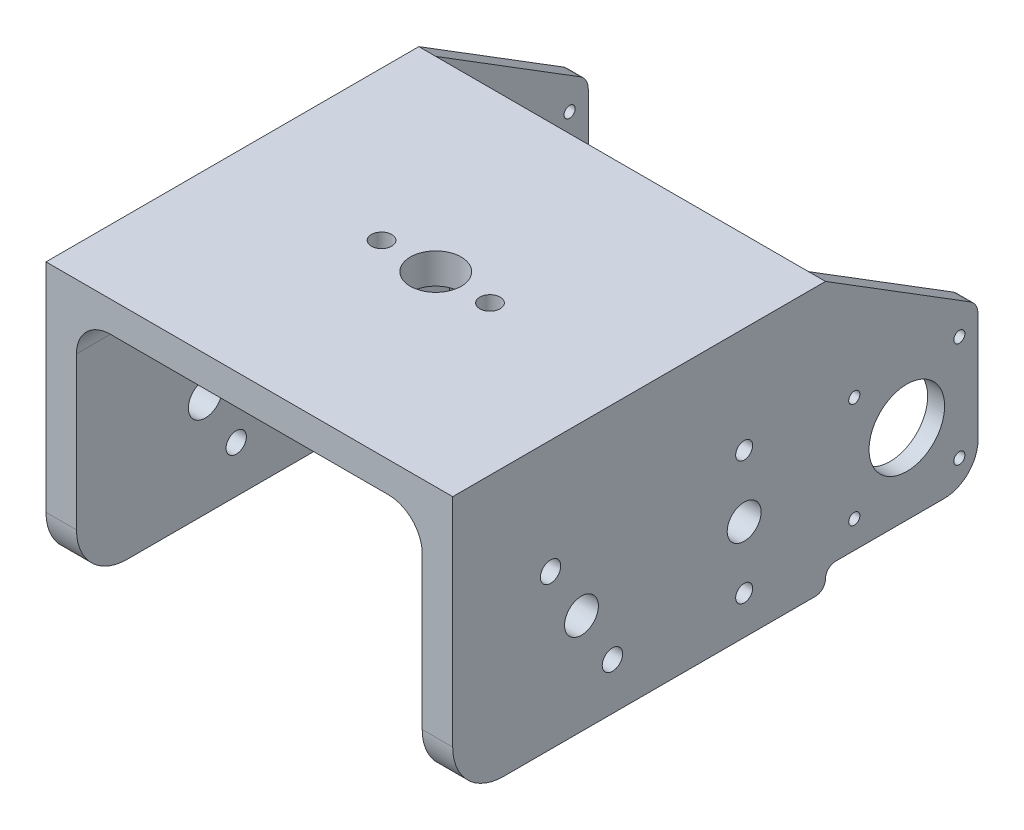
from build123d import *

# Parameters (mm, degrees)
SKETCH1_W               = 120
SKETCH1_H               = 110
BOSS_EXTRUDE1_DEPTH     = 9
SKETCH2_W               = 9
SKETCH2_H               = 110
BOSS_EXTRUDE2_DEPTH     = 70
SKETCH3_R               = 7.5
CUT_EXTRUDE1_DEPTH      = 70
SKETCH4_R               = 3
SKETCH4_R_2             = 5
SKETCH4_R_3             = 2.5
CUT_EXTRUDE2_DEPTH      = 150.415527975
FILLET1_R               = 10
SKETCH6_R               = 3
CUT_EXTRUDE4_DEPTH      = 10
FILLET2_R               = 15
SKETCH7_W               = 45
SKETCH7_H               = 45
SKETCH7_R               = 1.65
SKETCH7_R_2             = 11.15
BOSS_EXTRUDE3_DEPTH     = 5
BOSS_EXTRUDE4_START     = -5
SKETCH8_W               = 45
SKETCH8_H               = 45
SKETCH8_R               = 1.65
SKETCH8_R_2             = 11.15
BOSS_EXTRUDE4_DEPTH     = 5
FILLET3_R               = 15
FILLET5_R               = 3
BOSS_EXTRUDE5_DEPTH     = 120
CUT_EXTRUDE5_DEPTH      = 51
CUT_EXTRUDE5_DEPTH_BACK = 10
SKETCH11_W              = 110
SKETCH11_H              = 45
FILLET6_R               = 5
FILLET7_R               = 10
BOSS_EXTRUDE6_START     = -5
BOSS_EXTRUDE6_DEPTH     = 5
BOSS_EXTRUDE7_START     = -5
BOSS_EXTRUDE7_DEPTH     = 5


# Some blends are built 0.0001 mm under size
with BuildPart() as part:
    # Sketch1 → Boss-Extrude1 (new body)
    with BuildSketch(Plane(origin=(0, 0, 0), x_dir=(1, 0, 0), z_dir=(0, 1, 0))):
        Rectangle(SKETCH1_W, SKETCH1_H)
    extrude(amount=BOSS_EXTRUDE1_DEPTH)

    # Sketch2 → Boss-Extrude2 (add)
    with BuildSketch(Plane.XZ):
        with Locations((-55.5, 0)):
            Rectangle(SKETCH2_W, SKETCH2_H)
        with Locations((55.5, 0)):
            Rectangle(SKETCH2_W, SKETCH2_H)
    extrude(amount=BOSS_EXTRUDE2_DEPTH)

    # Sketch3 → Cut-Extrude1 (cut)
    with BuildSketch(Plane.XZ):
        with Locations(Location((0, 0, 0), (0, 0, 270))):
            Circle(SKETCH3_R)
    extrude(amount=-CUT_EXTRUDE1_DEPTH, mode=Mode.SUBTRACT)

    # Sketch4 → Cut-Extrude2 (cut, through all)
    with BuildSketch(Plane.ZY.offset(60)):
        with Locations((7.875, -56.203932664)):
            Circle(SKETCH4_R)
        with Locations((26.125, -24.594005426)):
            Circle(SKETCH4_R)
        with Locations((17, -40.398969045)):
            Circle(SKETCH4_R_2)
        with Locations((-31, -22.148969045)):
            Circle(SKETCH4_R_3)
        with Locations((-31, -58.648969045)):
            Circle(SKETCH4_R_3)
        with Locations((-31, -40.398969045)):
            Circle(SKETCH4_R_2)
    extrude(amount=-CUT_EXTRUDE2_DEPTH, mode=Mode.SUBTRACT)

    # Fillet1
    fillet1_edges = [part.edges().sort_by_distance(p)[0] for p in [
        (-51, 0, 0),
        (51, 0, 0),
    ]]
    fillet(fillet1_edges, radius=FILLET1_R)

    # Sketch6 → Cut-Extrude4 (cut)
    with BuildSketch(Plane(origin=(0, 9, 0), x_dir=(1, 0, 0), z_dir=(0, 1, 0))):
        with Locations(Location((-16, 0, 0), (0, 0, 270))):
            Circle(SKETCH6_R)
        with Locations(Location((16, 0, 0), (0, 0, 270))):
            Circle(SKETCH6_R)
    extrude(amount=-CUT_EXTRUDE4_DEPTH, mode=Mode.SUBTRACT)

    # Fillet2
    fillet2_edges = [part.edges().sort_by_distance(p)[0] for p in [
        (-55.5, -70, 55),
        (55.5, -70, 55),
    ]]
    fillet(fillet2_edges, radius=FILLET2_R)

    # Sketch7 → Boss-Extrude3 (add)
    with BuildSketch(Plane(origin=(60, 0, 0), x_dir=(0, 0, -1), z_dir=(1, 0, 0))):
        with Locations((77.5, -41.5)):
            Rectangle(SKETCH7_W, SKETCH7_H)
        with Locations((63.5, -24.898969045)):
            Circle(SKETCH7_R, mode=Mode.SUBTRACT)
        with Locations((94.5, -24.898969045)):
            Circle(SKETCH7_R, mode=Mode.SUBTRACT)
        with Locations((94.5, -55.898969045)):
            Circle(SKETCH7_R, mode=Mode.SUBTRACT)
        with Locations((63.5, -55.898969045)):
            Circle(SKETCH7_R, mode=Mode.SUBTRACT)
        with Locations((79, -40.398969045)):
            Circle(SKETCH7_R_2, mode=Mode.SUBTRACT)
    extrude(amount=-BOSS_EXTRUDE3_DEPTH)

    # Sketch8 → Boss-Extrude4 (add)
    with BuildSketch(Plane.ZY.offset(60).offset(BOSS_EXTRUDE4_START)):
        with Locations((-77.5, -41.5)):
            Rectangle(SKETCH8_W, SKETCH8_H)
        with Locations(Location((-94.5, -24.898969045, 0), (0, 0, 180))):
            Circle(SKETCH8_R, mode=Mode.SUBTRACT)
        with Locations(Location((-63.5, -24.898969045, 0), (0, 0, 180))):
            Circle(SKETCH8_R, mode=Mode.SUBTRACT)
        with Locations(Location((-94.5, -55.898969045, 0), (0, 0, 180))):
            Circle(SKETCH8_R, mode=Mode.SUBTRACT)
        with Locations(Location((-63.5, -55.898969045, 0), (0, 0, 180))):
            Circle(SKETCH8_R, mode=Mode.SUBTRACT)
        with Locations(Location((-79, -40.398969045, 0), (0, 0, 180))):
            Circle(SKETCH8_R_2, mode=Mode.SUBTRACT)
    extrude(amount=BOSS_EXTRUDE4_DEPTH)

    # Fillet3
    fillet3_edges = [part.edges().sort_by_distance(p)[0] for p in [
        (57.5, -19, -55),
        (-57.5, -19, -55),
    ]]
    fillet(fillet3_edges, radius=FILLET3_R)

    # Fillet5
    fillet5_edges = [part.edges().sort_by_distance(p)[0] for p in [
        (-57.5, -64, -55),
        (-55.5, -70, -55),
        (55.5, -70, -55),
        (57.5, -64, -55),
    ]]
    fillet(fillet5_edges, radius=FILLET5_R - 0.0001)  # a hair under: the kernel refuses the full size

    # Sketch10 → Boss-Extrude5 (add)
    with BuildSketch(Plane(origin=(60, 0, 0), x_dir=(0, 0, -1), z_dir=(1, 0, 0))):
        Polygon((55, 9), (100, -19), (90.555773444, -19), (55, 3.123592365), align=None)
    extrude(amount=-BOSS_EXTRUDE5_DEPTH)

    # Sketch11 → Cut-Extrude5 (cut, two sides: drawn at the far end of the back side and taken through both)
    with BuildSketch(Plane(origin=(0, 0, 0), x_dir=(-1, 0, 0), z_dir=(0, -1, 0)).offset(-CUT_EXTRUDE5_DEPTH_BACK)):
        with Locations((0, 77.5)):
            Rectangle(SKETCH11_W, SKETCH11_H)
    extrude(amount=CUT_EXTRUDE5_DEPTH + CUT_EXTRUDE5_DEPTH_BACK, mode=Mode.SUBTRACT)

    # Fillet6
    # the kernel refuses this fillet: 5 mm, written as the material it adds along each edge
    with BuildSketch(Plane(origin=(-55, 3.123592365, -55), x_dir=(0, -1, 0), z_dir=(-1, 0, 0)), Plane(origin=(60, 3.123592365, -55), x_dir=(0, -1, 0), z_dir=(-1, 0, 0))) as fillet6_piece_1:
        with BuildLine():
            CenterArc((FILLET6_R * 1.8, -FILLET6_R), FILLET6_R, 90, 121.890791802)
            Line((FILLET6_R * 0.950943396226, -FILLET6_R * 1.52830188679), (0, 0))
            Line((0, 0), (FILLET6_R * 1.8, 0))
        make_face()
    extrude(amount=5)
    with BuildSketch(Plane(origin=(-55, -19, -90.555773444), x_dir=(0, 0.528301886792453, 0.8490566037735847), z_dir=(-1, 0, 0))) as fillet6_piece_2:
        with BuildLine():
            CenterArc((FILLET6_R * 3.5, -FILLET6_R), FILLET6_R, 90, 148.109208198)
            Line((FILLET6_R * 2.97169811321, -FILLET6_R * 1.84905660377), (0, 0))
            Line((0, 0), (FILLET6_R * 3.5, 0))
        make_face()
    extrude(amount=5)
    with BuildSketch(Plane(origin=(60, -19, -90.555773444), x_dir=(0, 0, 1), z_dir=(-1, 0, 0))) as fillet6_piece_3:
        with BuildLine():
            CenterArc((FILLET6_R * 3.5, FILLET6_R), FILLET6_R, 121.890791802, 148.109208198)
            Line((FILLET6_R * 2.97169811321, FILLET6_R * 1.84905660377), (0, 0))
            Line((0, 0), (FILLET6_R * 3.5, 0))
        make_face()
    extrude(amount=5)
    # the kernel refuses this fillet: 5 mm, written as the material it takes off along each edge
    with BuildSketch(Plane(origin=(-48.055555556, -19, -100), x_dir=(0, 0.5283018867924467, 0.8490566037735887), z_dir=(-1, 0, 0))) as fillet6_2_piece_1:
        with BuildLine():
            CenterArc((FILLET6_R * 0.555555555556, -FILLET6_R), FILLET6_R, 90, 58.109208198)
            Line((-FILLET6_R * 0.293501048218, -FILLET6_R * 0.471698113208), (0, 0))
            Line((0, 0), (FILLET6_R * 0.555555555556, 0))
        make_face()
    extrude(amount=18.888888889, mode=Mode.SUBTRACT)
    with BuildSketch(Plane(origin=(66.944444444, -19, -100), x_dir=(0, -1, 0), z_dir=(-1, 0, 0))) as fillet6_2_piece_2:
        with BuildLine():
            CenterArc((FILLET6_R * 0.555555555556, FILLET6_R), FILLET6_R, 211.890791802, 58.109208198)
            Line((-FILLET6_R * 0.293501048218, FILLET6_R * 0.471698113208), (0, 0))
            Line((0, 0), (FILLET6_R * 0.555555555556, 0))
        make_face()
    extrude(amount=18.888888889, mode=Mode.SUBTRACT)

    # Fillet7
    fillet7_edges = [part.edges().sort_by_distance(p)[0] for p in [
        (57.5, -64, -100),
        (-57.5, -64, -100),
    ]]
    fillet(fillet7_edges, radius=FILLET7_R)

    # Sketch12 → Boss-Extrude6 (add)
    with BuildSketch(Plane.ZY.offset(60).offset(BOSS_EXTRUDE6_START)):
        Polygon((-58.940723001, 2.767041623), (-81.499265811, -11.693562742), (-78.607144938, -21.141157594), (-64.532156689, -21.141157594), (-49.355143029, -12.186463132), (-49.355143029, -1.853525156), align=None)
    extrude(amount=BOSS_EXTRUDE6_DEPTH)

    # Sketch13 → Boss-Extrude7 (add)
    with BuildSketch(Plane(origin=(60, 0, 0), x_dir=(0, 0, -1), z_dir=(1, 0, 0)).offset(BOSS_EXTRUDE7_START)):
        Polygon((56.819834361, 2.885240591), (82.463306102, -10.418515425), (80.920841636, -18.902069986), (69.641570231, -22.372615034), (52.57805708, -14.660292706), (45.05854281, -6.562354261), (48.818299945, 0.68471384), (56.819834361, 0.68471384), align=None)
    extrude(amount=BOSS_EXTRUDE7_DEPTH)


solid = part.part
